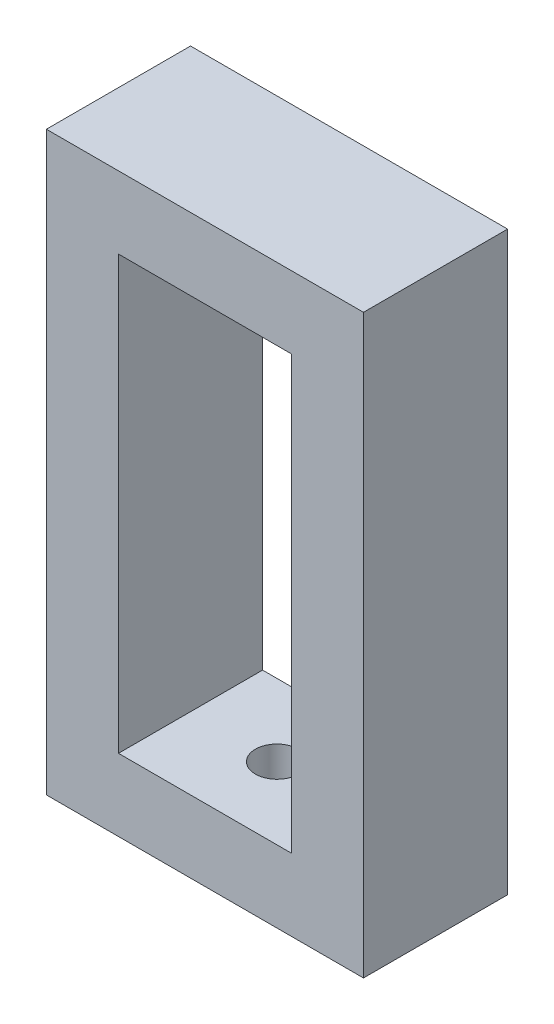
from build123d import *

# Parameters (mm, degrees)
SKETCH1_W           = 22
SKETCH1_H           = 40
SKETCH1_W_2         = 12
SKETCH1_H_2         = 30
BOSS_EXTRUDE1_DEPTH = 10
SKETCH2_R           = 1.5
CUT_EXTRUDE1_DEPTH  = 15


with BuildPart() as part:
    # Sketch1 → Boss-Extrude1 (new body)
    with BuildSketch(Plane.XY):
        with Locations((11, 20)):
            Rectangle(SKETCH1_W, SKETCH1_H)
        with Locations((11, 20)):
            Rectangle(SKETCH1_W_2, SKETCH1_H_2, mode=Mode.SUBTRACT)
    extrude(amount=BOSS_EXTRUDE1_DEPTH)

    # Sketch2 → Cut-Extrude1 (cut, symmetric)
    with BuildSketch(Plane(origin=(0, 0, 0), x_dir=(1, 0, 0), z_dir=(0, 1, 0))):
        with Locations((11, -5)):
            Circle(SKETCH2_R)
    extrude(amount=CUT_EXTRUDE1_DEPTH, both=True, mode=Mode.SUBTRACT)


solid = part.part
